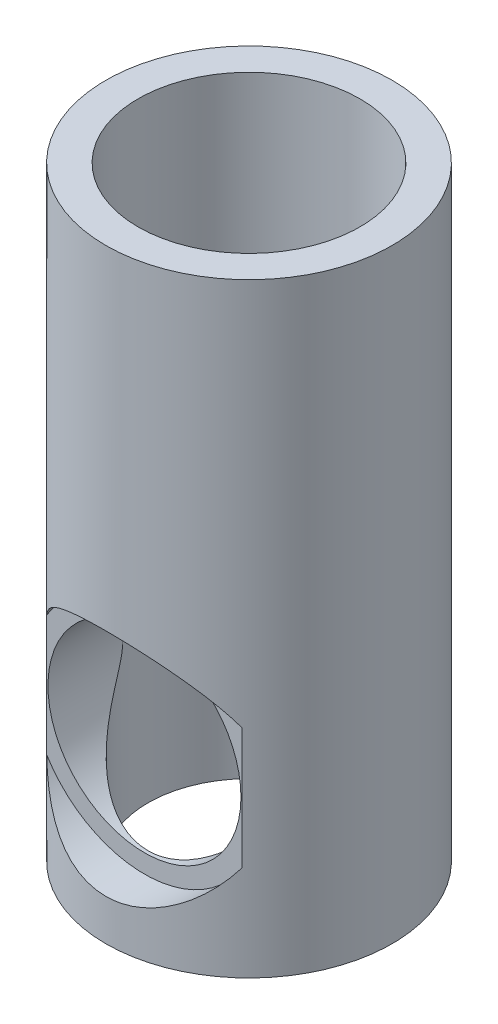
from build123d import *
from build123d.topology import SkipClean

# Parameters (mm, degrees)
SKETCH1_R               = 8.9
SKETCH1_R_2             = 6.28
BOSS_EXTRUDE1_DEPTH     = 19.1
BOSS_EXTRUDE2_START     = -18.5
SKETCH2_R               = 8.9
SKETCH2_R_2             = 6.9
BOSS_EXTRUDE2_DEPTH     = 18.5
CUT_EXTRUDE5_START      = 6.5
SKETCH3_R               = 7.15
CUT_EXTRUDE5_DEPTH      = 17.374221298
CUT_EXTRUDE6_DEPTH      = 27.099425447
CUT_EXTRUDE6_DEPTH_BACK = 7
SKETCH6_R               = 6


with BuildPart() as part:
    # Sketch1 → Boss-Extrude1 (new body)
    with BuildSketch(Plane(origin=(0, 0, 0), x_dir=(1, 0, 0), z_dir=(0, 1, 0))):
        Circle(SKETCH1_R)
        Circle(SKETCH1_R_2, mode=Mode.SUBTRACT)
    extrude(amount=-BOSS_EXTRUDE1_DEPTH)

    # Sketch2 → Boss-Extrude2 (add)
    with SkipClean():  # the faces are left unmerged after this step: merging them gives an invalid solid
        with BuildSketch(Plane(origin=(0, 0, 0), x_dir=(-1, 0, 0), z_dir=(0, -1, 0)).offset(BOSS_EXTRUDE2_START)):
            Circle(SKETCH2_R)
            Circle(SKETCH2_R_2, mode=Mode.SUBTRACT)
        extrude(amount=BOSS_EXTRUDE2_DEPTH)

    # Sketch3 → Cut-Extrude5 (cut, through all)
    with SkipClean():  # the faces are left unmerged after this step: merging them gives an invalid solid
        with BuildSketch(Plane.XY.offset(CUT_EXTRUDE5_START)):
            with Locations((0, -9.4)):
                Circle(SKETCH3_R)
        extrude(amount=CUT_EXTRUDE5_DEPTH, mode=Mode.SUBTRACT)

    # Sketch6 → Cut-Extrude6 (cut, two sides: drawn at the far end of the back side and taken through both)
    with SkipClean():  # the faces are left unmerged after this step: merging them gives an invalid solid
        with BuildSketch(Plane.XY.offset(6.5).offset(-CUT_EXTRUDE6_DEPTH_BACK)):
            with Locations((0, -9.4)):
                Circle(SKETCH6_R)
        extrude(amount=CUT_EXTRUDE6_DEPTH + CUT_EXTRUDE6_DEPTH_BACK, mode=Mode.SUBTRACT)


solid = part.part
